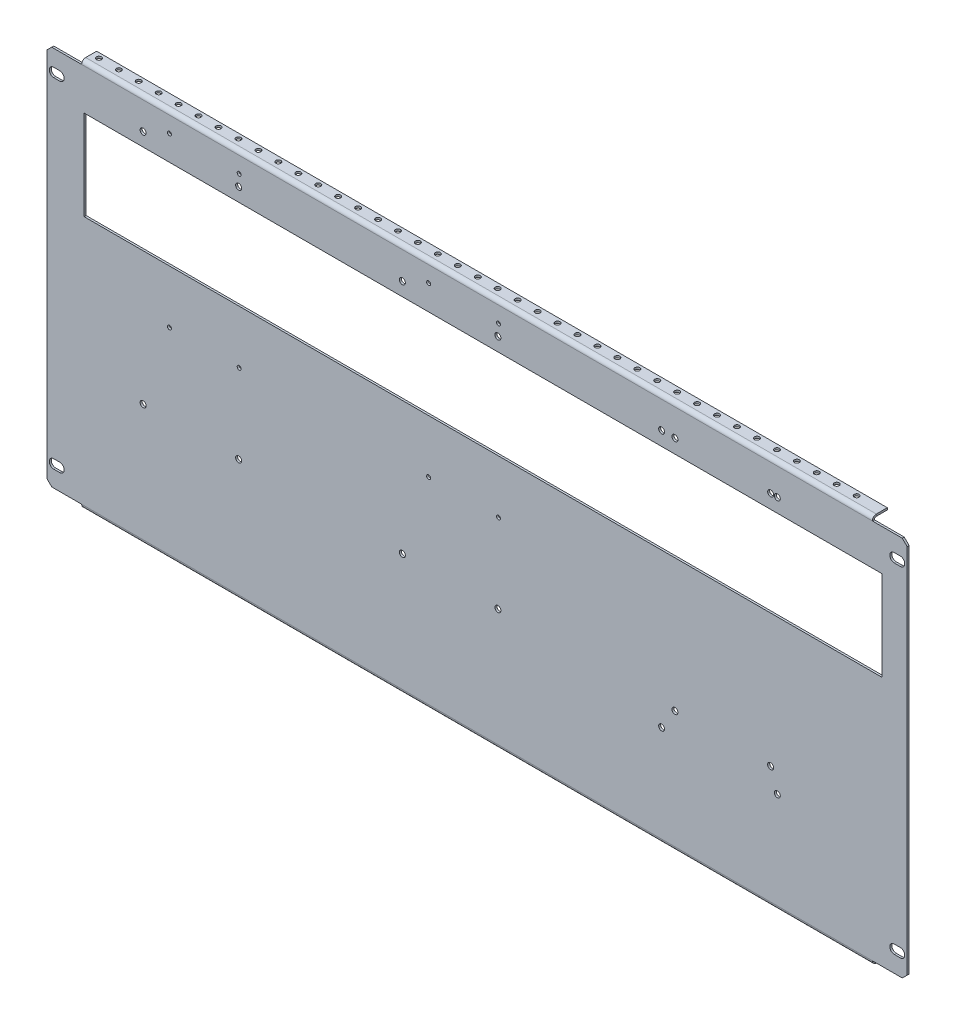
from build123d import *

# Parameters (mm, degrees)
SKETCH_1_W                       = 863
SKETCH_1_H                       = 382
SM_BASE_FLANGE_1_DEPTH           = 2
CUT_EXTRUDE_1_DEPTH              = 472.886903823
MIRROR_2_COPY_1_DEPTH            = 472.886903823
SM_EDGE_FLANGE_1_DEPTH           = 793
CHAMFER_1_SIZE                   = 5
CUT_EXTRUDE_2_DEPTH              = 474.753364104
CUT_EXTRUDE_2_DEPTH_BACK         = 474.753364104
SKETCH_10_W                      = 800
SKETCH_10_H                      = 90
SKETCH_11_R                      = 2
CUT_EXTRUDE_3_DEPTH              = 474.753364104
PATTERN_LINEAR_1_COUNT           = 2
PATTERN_LINEAR_1_PITCH           = 70
PATTERN_LINEAR_1_COUNT_DIR2      = 2
PATTERN_LINEAR_1_PITCH_DIR2      = 168.5
PATTERN_LINEAR_2_COUNT           = 2
PATTERN_LINEAR_2_PITCH           = 260
PATTERN_LINEAR_2_COPY_1_SKETCH_R = 2
PATTERN_LINEAR_2_COPY_1_DEPTH    = 474.753364104
PATTERN_LINEAR_2_COPY_2_SKETCH_R = 2
PATTERN_LINEAR_2_COPY_2_DEPTH    = 474.753364104
PATTERN_LINEAR_2_COPY_3_SKETCH_R = 2
PATTERN_LINEAR_2_COPY_3_DEPTH    = 474.753364104
SKETCH_12_R                      = 3
CUT_EXTRUDE_4_DEPTH              = 474.753364104
PATTERN_LINEAR_3_COUNT           = 2
PATTERN_LINEAR_3_PITCH           = 96
PATTERN_LINEAR_3_COUNT_DIR2      = 2
PATTERN_LINEAR_3_PITCH_DIR2      = 237
SKETCH_13_R                      = 3
CUT_EXTRUDE_5_DEPTH              = 10
SKETCH_15_R                      = 2.5
CUT_EXTRUDE_6_DEPTH              = 582.822352613
PATTERN_LINEAR_4_COUNT           = 39
PATTERN_LINEAR_4_PITCH           = 20


# Sheet-metal steps are written as plain solids
with BuildPart() as part:
    # Sketch 1 → 基体-法兰1 (new body)
    with BuildSketch(Plane.XY):
        Rectangle(SKETCH_1_W, SKETCH_1_H)
    extrude(amount=-SM_BASE_FLANGE_1_DEPTH)

    # 草图6 → 切除-拉伸1 (cut, symmetric)
    with BuildSketch(Plane.XY):
        with BuildLine():
            Line((-424.5, 174.5), (-418.5, 174.5))
            ThreePointArc((-418.5, 174.5), (-414, 170), (-418.5, 165.5))
            Line((-418.5, 165.5), (-424.5, 165.5))
            ThreePointArc((-424.5, 165.5), (-429, 170), (-424.5, 174.5))
        make_face()
    cut_extrude_1 = extrude(amount=CUT_EXTRUDE_1_DEPTH, both=True, mode=Mode.SUBTRACT)

    # 镜向1: 切除-拉伸1 across plane
    add(cut_extrude_1.mirror(Plane.ZX), mode=Mode.SUBTRACT)

    # 镜向2: 切除-拉伸1 across plane
    add(cut_extrude_1.mirror(Plane.ZY), mode=Mode.SUBTRACT)

    # 镜向2 copy 1 sketch → 镜向2 copy 1 (cut, symmetric)
    with BuildSketch(Plane(origin=(0, 0, 0), x_dir=(-1, 0, 0), z_dir=(0, 0, 1))):
        with BuildLine():
            Line((-424.5, 174.5), (-418.5, 174.5))
            ThreePointArc((-418.5, 174.5), (-414, 170), (-418.5, 165.5))
            Line((-418.5, 165.5), (-424.5, 165.5))
            ThreePointArc((-424.5, 165.5), (-429, 170), (-424.5, 174.5))
        make_face()
    extrude(amount=MIRROR_2_COPY_1_DEPTH, both=True, mode=Mode.SUBTRACT)

    # 边线-法兰1 section (across the edge) → 边线-法兰1 (add)
    with BuildSketch(Plane(origin=(-396.5, 193, -2), x_dir=(0, -1, 0), z_dir=(1, 0, 0))):
        with BuildLine():
            Line((-2, 2), (-2, 13))
            Line((-2, 13), (0, 13))
            Line((0, 13), (0, 2))
            ThreePointArc((0, 2), (0.585786438, 0.585786438), (2, 0))
            Line((2, 0), (2, -2))
            ThreePointArc((2, -2), (-0.828427125, -0.828427125), (-2, 2))
        make_face()
    sm_edge_flange_1 = extrude(amount=SM_EDGE_FLANGE_1_DEPTH)

    # 镜向3: 边线-法兰1 across plane
    add(sm_edge_flange_1.mirror(Plane.ZX))

    # 倒角1
    chamfer_1_edges = [part.edges().sort_by_distance(p)[0] for p in [
        (431.5, -191, -1),
        (-431.5, -191, -1),
        (-431.5, 191, -1),
        (431.5, 191, -1),
    ]]
    chamfer(chamfer_1_edges, length=CHAMFER_1_SIZE)

    # 草图10 → 切除-拉伸2 (cut, two sides: drawn at the far end of the back side and taken through both)
    with BuildSketch(Plane.XY.offset(-CUT_EXTRUDE_2_DEPTH_BACK)):
        with Locations((6, 105)):
            Rectangle(SKETCH_10_W, SKETCH_10_H)
    extrude(amount=CUT_EXTRUDE_2_DEPTH + CUT_EXTRUDE_2_DEPTH_BACK, mode=Mode.SUBTRACT)

    # 草图11 → 切除-拉伸3 (cut, symmetric)
    with BuildSketch(Plane.XY):
        with Locations((-308.5, 175)):
            Circle(SKETCH_11_R)
    cut_extrude_3 = extrude(amount=CUT_EXTRUDE_3_DEPTH, both=True, mode=Mode.SUBTRACT)

    # 阵列(线性)1: Cut-Extrude 3 2 × 2
    with Locations(*[(i * PATTERN_LINEAR_1_PITCH, -j * PATTERN_LINEAR_1_PITCH_DIR2, 0) for i in range(PATTERN_LINEAR_1_COUNT) for j in range(PATTERN_LINEAR_1_COUNT_DIR2) if (i, j) != (0, 0)]):
        add(cut_extrude_3, mode=Mode.SUBTRACT)

    # 阵列(线性)2: 切除-拉伸3 ×2
    with Locations(*[(i * PATTERN_LINEAR_2_PITCH, 0, 0) for i in range(1, PATTERN_LINEAR_2_COUNT)]):
        add(cut_extrude_3, mode=Mode.SUBTRACT)

    # 阵列(线性)2 copy 1 sketch → 阵列(线性)2 copy 1 (cut, symmetric)
    with BuildSketch(Plane(origin=(260, -168.5, 0), x_dir=(1, 0, 0), z_dir=(0, 0, 1))):
        with Locations((-308.5, 175)):
            Circle(PATTERN_LINEAR_2_COPY_1_SKETCH_R)
    extrude(amount=PATTERN_LINEAR_2_COPY_1_DEPTH, both=True, mode=Mode.SUBTRACT)

    # 阵列(线性)2 copy 2 sketch → 阵列(线性)2 copy 2 (cut, symmetric)
    with BuildSketch(Plane(origin=(330, 0, 0), x_dir=(1, 0, 0), z_dir=(0, 0, 1))):
        with Locations((-308.5, 175)):
            Circle(PATTERN_LINEAR_2_COPY_2_SKETCH_R)
    extrude(amount=PATTERN_LINEAR_2_COPY_2_DEPTH, both=True, mode=Mode.SUBTRACT)

    # 阵列(线性)2 copy 3 sketch → 阵列(线性)2 copy 3 (cut, symmetric)
    with BuildSketch(Plane(origin=(330, -168.5, 0), x_dir=(1, 0, 0), z_dir=(0, 0, 1))):
        with Locations((-308.5, 175)):
            Circle(PATTERN_LINEAR_2_COPY_3_SKETCH_R)
    extrude(amount=PATTERN_LINEAR_2_COPY_3_DEPTH, both=True, mode=Mode.SUBTRACT)

    # 草图12 → 切除-拉伸4 (cut, symmetric)
    with BuildSketch(Plane.XY):
        with Locations((198.5, 164)):
            Circle(SKETCH_12_R)
    cut_extrude_4 = extrude(amount=CUT_EXTRUDE_4_DEPTH, both=True, mode=Mode.SUBTRACT)

    # 阵列(线性)3: Cut-Extrude 4 2 × 2
    with Locations(*[(i * PATTERN_LINEAR_3_PITCH, -j * PATTERN_LINEAR_3_PITCH_DIR2, 0) for i in range(PATTERN_LINEAR_3_COUNT) for j in range(PATTERN_LINEAR_3_COUNT_DIR2) if (i, j) != (0, 0)]):
        add(cut_extrude_4, mode=Mode.SUBTRACT)

    # 草图13 → 切除-拉伸5 (cut)
    with BuildSketch(Plane.XY):
        with Locations((-334.865282206, -73.25)):
            Circle(SKETCH_13_R)
        with Locations((-334.865282205, 163.5)):
            Circle(SKETCH_13_R)
        with Locations((-239.065282206, -73.25)):
            Circle(SKETCH_13_R)
        with Locations((-239.065282205, 163.5)):
            Circle(SKETCH_13_R)
        with Locations((-74.865282206, -73.25)):
            Circle(SKETCH_13_R)
        with Locations((20.934717794, -73.25)):
            Circle(SKETCH_13_R)
        with Locations((20.934717795, 163.5)):
            Circle(SKETCH_13_R)
        with Locations((-74.865282205, 163.5)):
            Circle(SKETCH_13_R)
        with Locations((185.184717794, -94.1)):
            Circle(SKETCH_13_R)
        with Locations((301.184717794, -94.1)):
            Circle(SKETCH_13_R)
        with Locations((301.184717795, 163.9)):
            Circle(SKETCH_13_R)
        with Locations((185.184717795, 163.9)):
            Circle(SKETCH_13_R)
    extrude(amount=-CUT_EXTRUDE_5_DEPTH, mode=Mode.SUBTRACT)

    # 草图15 → 切除-拉伸6 (cut, symmetric)
    with BuildSketch(Plane(origin=(0, 195, 0), x_dir=(1, 0, 0), z_dir=(0, 1, 0))):
        with Locations(Location((-389.223353738, 10, 0), (0, 0, 270))):
            Circle(SKETCH_15_R)
    cut_extrude_6 = extrude(amount=CUT_EXTRUDE_6_DEPTH, both=True, mode=Mode.SUBTRACT)

    # 阵列(线性)4: 切除-拉伸6 ×39
    with Locations(*[(i * PATTERN_LINEAR_4_PITCH, 0, 0) for i in range(1, PATTERN_LINEAR_4_COUNT)]):
        add(cut_extrude_6, mode=Mode.SUBTRACT)


solid = part.part
